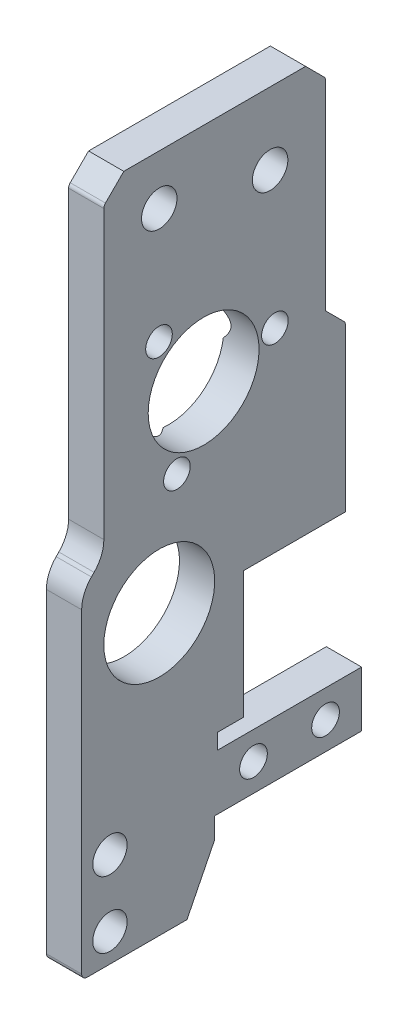
from build123d import *

# Parameters (mm, degrees)
SKETCH1_R                                       = 5
SKETCH1_R_2                                     = 1.6
SKETCH1_R_3                                     = 1.25
SKETCH1_R_4                                     = 1.55
BOSS_EXTRUDE1_DEPTH                             = 3.18
CHAMFER1_SIZE                                   = 2.5
CHAMFER1_SIZE2                                  = 4.998920521
CSK_FOR_M2_FLAT_HEAD_MACHINE_SCREW1_D           = 2.4
CSK_FOR_M2_FLAT_HEAD_MACHINE_SCREW1_DEPTH       = 3.508967257
CSK_FOR_M2_FLAT_HEAD_MACHINE_SCREW1_CSINK_D     = 4.4
CSK_FOR_M2_FLAT_HEAD_MACHINE_SCREW1_CSINK_ANGLE = 90
CSK_FOR_M2_FLAT_HEAD_MACHINE_SCREW1_TIP         = 0.721032743
SKETCH3_R                                       = 5
CUT_EXTRUDE4_DEPTH                              = 67.382158748
FILLET2_R                                       = 3
CHAMFER2_SIZE                                   = 1.8
FILLET4_R                                       = 0.5


with BuildPart() as part:
    # Sketch1 → Boss-Extrude1 (new body)
    with BuildSketch(Plane(origin=(0, 0, 0), x_dir=(0, 0, -1), z_dir=(1, 0, 0))):
        Polygon((0, 0), (0, 30.2), (2, 32.2), (2, 61.31), (22, 61.31), (22, 41.31), (23.8, 41.31), (23.8, 24.71), (14.6, 24.71), (14.6, 13.26), (12.25, 13.26), (12.25, 11.86), (25.25, 11.86), (25.25, 6.86), (12, 6.86), (12, 0), align=None)
        with Locations(Location((7, 25.2, 0), (0, 0, 180))):
            Circle(SKETCH1_R, mode=Mode.SUBTRACT)
        with Locations(Location((7, 56.81, 0), (0, 0, 180))):
            Circle(SKETCH1_R_2, mode=Mode.SUBTRACT)
        with Locations(Location((17, 54.81, 0), (0, 0, 180))):
            Circle(SKETCH1_R_2, mode=Mode.SUBTRACT)
        with Locations(Location((22, 9.36, 0), (0, 0, 180))):
            Circle(SKETCH1_R_3, mode=Mode.SUBTRACT)
        with Locations(Location((15.5, 9.36, 0), (0, 0, 180))):
            Circle(SKETCH1_R_3, mode=Mode.SUBTRACT)
        with Locations(Location((2.55, 2.55, 0), (0, 0, 180))):
            Circle(SKETCH1_R_4, mode=Mode.SUBTRACT)
        with Locations(Location((2.55, 8.55, 0), (0, 0, 180))):
            Circle(SKETCH1_R_4, mode=Mode.SUBTRACT)
    extrude(amount=BOSS_EXTRUDE1_DEPTH)

    # Chamfer1
    chamfer1_edges = [part.edges().sort_by_distance(p)[0] for p in [
        (1.59, 0, -12),
    ]]
    chamfer1_side = [part.faces().sort_by_distance(p)[0] for p in [
        (1.59, 0, -6),
    ]]
    chamfer(chamfer1_edges, length=CHAMFER1_SIZE, length2=CHAMFER1_SIZE2, reference=chamfer1_side[0])

    # CSK for M2 Flat Head Machine Screw1
    with Locations(Plane.ZY):
        with Locations((-6.974936087, 46.414674329), (-17.432559713, 42.244769284), (-8.592504199, 35.273154083)):
            CounterSinkHole(CSK_FOR_M2_FLAT_HEAD_MACHINE_SCREW1_D / 2, CSK_FOR_M2_FLAT_HEAD_MACHINE_SCREW1_CSINK_D / 2, depth=CSK_FOR_M2_FLAT_HEAD_MACHINE_SCREW1_DEPTH, counter_sink_angle=CSK_FOR_M2_FLAT_HEAD_MACHINE_SCREW1_CSINK_ANGLE)
            with Locations((0, 0, -(CSK_FOR_M2_FLAT_HEAD_MACHINE_SCREW1_DEPTH + CSK_FOR_M2_FLAT_HEAD_MACHINE_SCREW1_TIP / 2))):  # 118° drill point
                Cone(0, CSK_FOR_M2_FLAT_HEAD_MACHINE_SCREW1_D / 2, CSK_FOR_M2_FLAT_HEAD_MACHINE_SCREW1_TIP, mode=Mode.SUBTRACT)

    # Sketch3 → Cut-Extrude4 (cut, through all)
    with BuildSketch(Plane.ZY):
        with Locations((-11, 41.310865899)):
            Circle(SKETCH3_R)
    extrude(amount=-CUT_EXTRUDE4_DEPTH, mode=Mode.SUBTRACT)

    # Fillet2
    fillet2_edges = [part.edges().sort_by_distance(p)[0] for p in [
        (1.59, 30.2, 0),
        (1.59, 32.2, -2),
    ]]
    fillet(fillet2_edges, radius=FILLET2_R)

    # Chamfer2
    chamfer2_edges = [part.edges().sort_by_distance(p)[0] for p in [
        (1.59, 61.31, -22),
        (1.59, 61.31, -2),
        (1.59, 41.31, -23.8),
    ]]
    chamfer(chamfer2_edges, length=CHAMFER2_SIZE - 0.0001)  # a hair under: the kernel refuses the full size

    # Fillet4
    fillet4_edges = [part.edges().sort_by_distance(p)[0] for p in [
        (1.59, 39.5101, -23.8),
        (1.59, 59.5101, -22),
        (1.59, 59.5101, -2),
        (1.59, 0, 0),
        (1.59, 4.998920521, -12),
    ]]
    fillet(fillet4_edges, radius=FILLET4_R)


solid = part.part
